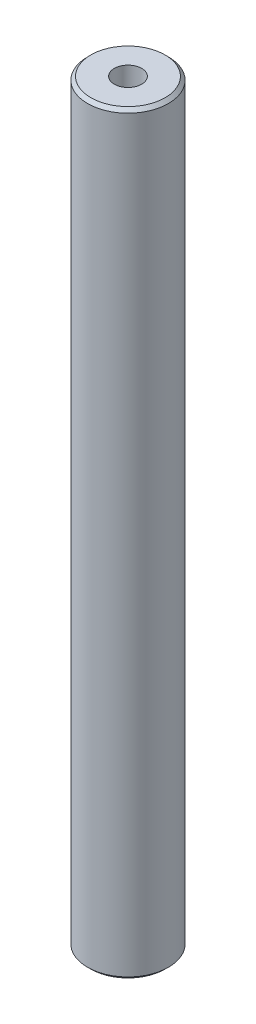
from build123d import *
from OCP.BRepFilletAPI import BRepFilletAPI_MakeChamfer

# Parameters (mm, degrees)
SKETCH1_R           = 25
BOSS_EXTRUDE1_DEPTH = 466.85479026
SKETCH2_R           = 8.482621494
CUT_EXTRUDE1_DEPTH  = 469.191622296
CHAMFER1_SIZE       = 2.097240103
CHAMFER1_SIZE2      = 2.042182231


with BuildPart() as part:
    # Sketch1 → Boss-Extrude1 (new body)
    with BuildSketch(Plane(origin=(0, 0, 0), x_dir=(1, 0, 0), z_dir=(0, 1, 0))):
        Circle(SKETCH1_R)
    extrude(amount=BOSS_EXTRUDE1_DEPTH)

    # Sketch2 → Cut-Extrude1 (cut, through all)
    with BuildSketch(Plane(origin=(0, 0, 0), x_dir=(1, 0, 0), z_dir=(0, 1, 0))):
        Circle(SKETCH2_R)
    extrude(amount=CUT_EXTRUDE1_DEPTH, mode=Mode.SUBTRACT)

    # Chamfer1: one chamfer whose edges measure the first distance from different faces: ONE call of the kernel's chamfer builder (chamfer() names one face for all edges)
    chamfer1_edges_1 = [part.edges().sort_by_distance(p)[0] for p in [
        (-25, 466.85479026, 0),
    ]]
    chamfer1_side_1 = [part.faces().sort_by_distance(p)[0] for p in [
        (-25, 233.42739513, 0),
    ]]
    chamfer1_edges_2 = [part.edges().sort_by_distance(p)[0] for p in [
        (-25, 0, 0),
    ]]
    chamfer1_side_2 = [part.faces().sort_by_distance(p)[0] for p in [
        (-24.292893219, 0, 0),
    ]]
    chamfer1 = BRepFilletAPI_MakeChamfer(part.part.solid().wrapped)
    for e in chamfer1_edges_1:
        chamfer1.Add(CHAMFER1_SIZE, CHAMFER1_SIZE2, e.wrapped, chamfer1_side_1[0].wrapped)  # the first distance lies on this face
    for e in chamfer1_edges_2:
        chamfer1.Add(CHAMFER1_SIZE, CHAMFER1_SIZE2, e.wrapped, chamfer1_side_2[0].wrapped)  # the first distance lies on this face
    add(Compound.cast(chamfer1.Shape()), mode=Mode.REPLACE)


solid = part.part
